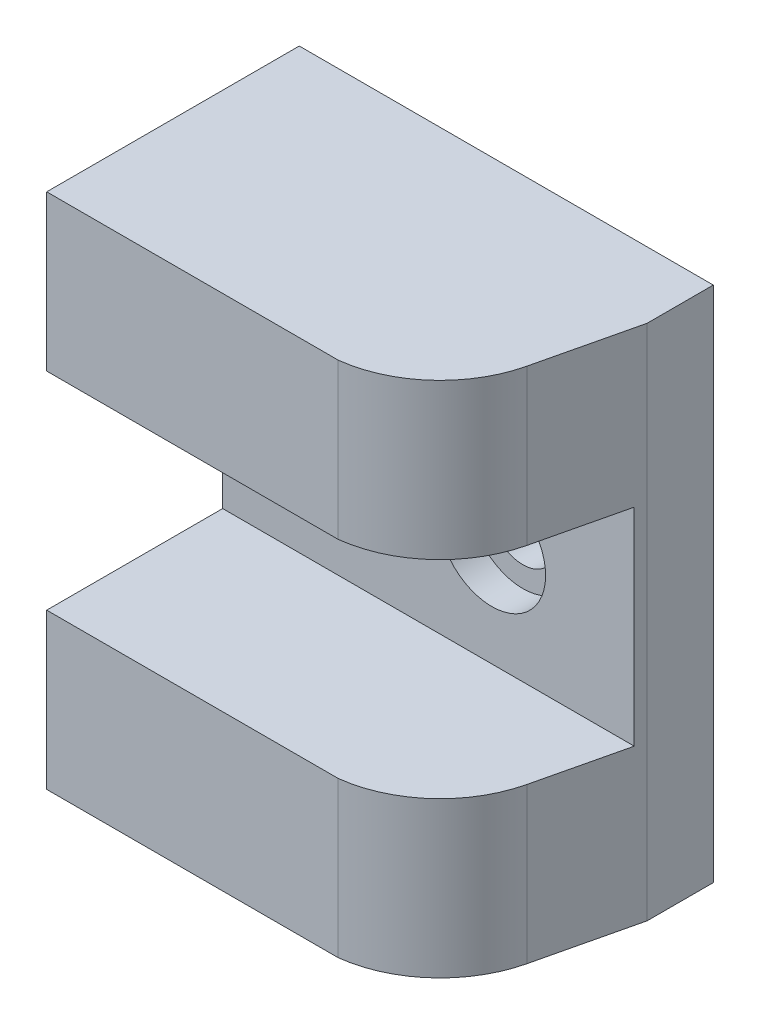
from build123d import *

# Parameters (mm, degrees)
SKETCH_1_W                   = 20
SKETCH_1_H                   = 25
EXTRUDE_1_DEPTH              = 12.2
CUT_EXTRUDE_1_DEPTH          = 26.5
SKETCH_3_W                   = 20
SKETCH_3_H                   = 10
CUT_EXTRUDE_2_DEPTH          = 8.5
HOLE_WIZARD_M3_1_D           = 3.2
HOLE_WIZARD_M3_1_CBORE_D     = 5.2
HOLE_WIZARD_M3_1_CBORE_DEPTH = 1.5


with BuildPart() as part:
    # 草图1 → 凸台-拉伸1 (new body)
    with BuildSketch(Plane.XY):
        with Locations((117, 92.5)):
            Rectangle(SKETCH_1_W, SKETCH_1_H)
    extrude(amount=EXTRUDE_1_DEPTH)

    # 草图2 → 切除-拉伸1 (cut)
    with BuildSketch(Plane(origin=(0, 105, 0), x_dir=(1, 0, 0), z_dir=(0, 1, 0))):
        with BuildLine():
            Line((125.890619014, -7.895997518), (127, -3.195997518))
            Line((127, -3.195997518), (127, -12.2))
            Line((127, -12.2), (121.083012976, -12.2))
            ThreePointArc((121.083012976, -12.2), (124.162916731, -10.803208822), (125.890619014, -7.895997518))
        make_face()
    extrude(amount=-CUT_EXTRUDE_1_DEPTH, mode=Mode.SUBTRACT)

    # 草图3 → 切除-拉伸2 (cut)
    with BuildSketch(Plane.XY.offset(12.2)):
        with Locations((117, 92.5)):
            Rectangle(SKETCH_3_W, SKETCH_3_H)
    extrude(amount=-CUT_EXTRUDE_2_DEPTH, mode=Mode.SUBTRACT)

    # M3 六角头螺栓的柱形沉头孔1 (through all)
    with Locations(Plane.XY.offset(3.7)):
        with Locations((112, 92.5), (120, 92.5)):
            CounterBoreHole(HOLE_WIZARD_M3_1_D / 2, HOLE_WIZARD_M3_1_CBORE_D / 2, HOLE_WIZARD_M3_1_CBORE_DEPTH)


solid = part.part
